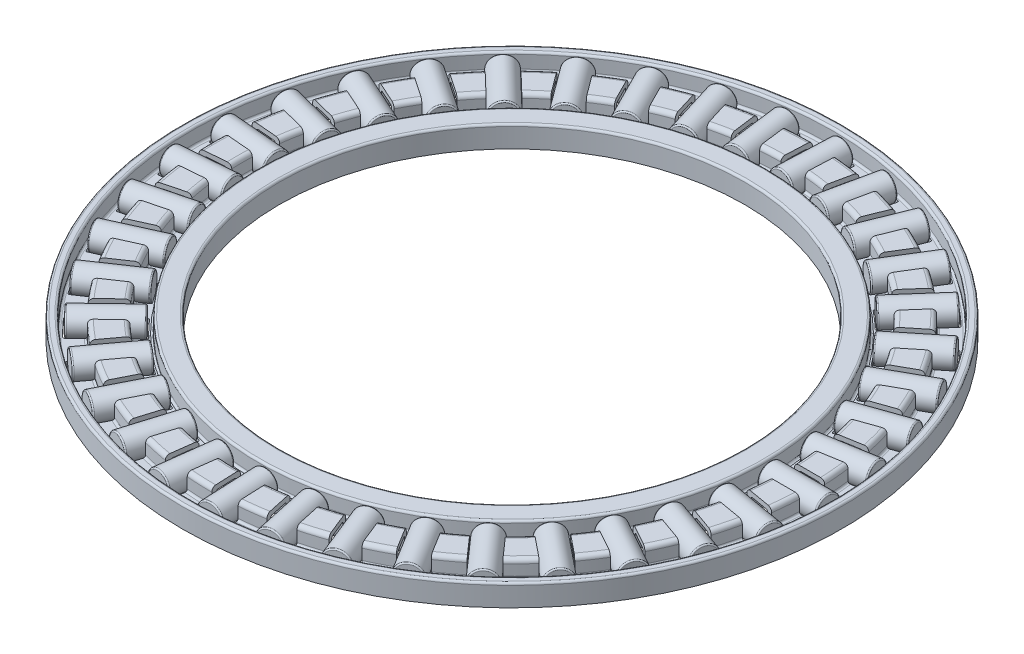
from build123d import *

# Parameters (mm, degrees)
FILLET1_R                = 0.492307692
FILLET2_R                = 0.492307692
FILLET3_R                = 0.25
FILLET4_R                = 0.246153846
CUT_EXTRUDE1_DEPTH       = 56.169064092
FILLET5_R                = 0.150039816
CIRPATTERN1_COUNT        = 37
FILLET5_OF_CIRPATTERN1_R = 0.150039816
SKETCH5_W                = 6.905422351
SKETCH5_H                = 1.5
FILLET6_R                = 0.150039816
CIRPATTERN2_COUNT        = 37


with BuildPart() as part:
    # Sketch3 → Revolve1 (revolve)
    with BuildSketch(Plane(origin=(0, 0, 0), x_dir=(0, 0, -1), z_dir=(1, 0, 0))):
        Polygon((28.353333333, -1.275), (28.353333333, 0.722307692), (29.176666667, 0.722307692), (29.176666667, -1.275), (32.524230769, -1.275), (32.524230769, 0.722307692), (34.985769231, 0.722307692), (34.985769231, -1.275), (38.333333333, -1.275), (38.333333333, 0.722307692), (38.666666667, 0.722307692), (38.666666667, -1.275), (39, -1.275), (39, 1.275), (38, 1.275), (38, -0.722307692), (35.538461538, -0.722307692), (35.538461538, 1.275), (31.971538462, 1.275), (31.971538462, -0.722307692), (30, -0.722307692), (30, 1.275), (27.53, 1.275), (27.53, -1.275), align=None)
    revolve(axis=Axis((0, 1.5, 0), (0, -1, 0)))

    # Fillet1
    fillet1_edges = [part.edges().sort_by_distance(p)[0] for p in [
        (0, -1.275, 34.985769231),
        (0, -1.275, 38.333333333),
        (0, -1.275, 29.176666667),
        (0, -1.275, 32.524230769),
    ]]
    fillet(fillet1_edges, radius=FILLET1_R)

    # Fillet2
    fillet2_edges = [part.edges().sort_by_distance(p)[0] for p in [
        (0, 1.275, 35.538461538),
        (0, 1.275, 31.971538462),
    ]]
    fillet(fillet2_edges, radius=FILLET2_R)

    # Fillet3
    fillet3_edges = [part.edges().sort_by_distance(p)[0] for p in [
        (0, 1.275, 38),
        (0, 1.275, 39),
        (0, 1.275, 30),
        (0, 1.275, 27.53),
    ]]
    fillet(fillet3_edges, radius=FILLET3_R)

    # Fillet4
    fillet4_edges = [part.edges().sort_by_distance(p)[0] for p in [
        (0, 0.722307692, 32.524230769),
        (0, 0.722307692, 34.985769231),
        (0, -0.722307692, 38),
        (0, -0.722307692, 35.538461538),
        (0, -0.722307692, 31.971538462),
        (0, -0.722307692, 30),
    ]]
    fillet(fillet4_edges, radius=FILLET4_R)

    # Sketch4 → Cut-Extrude1 (cut, symmetric)
    with BuildSketch(Plane(origin=(0, 0, 0), x_dir=(1, 0, 0), z_dir=(0, 1, 0))):
        with BuildLine():
            Line((30.362970869, 1.5), (37.570067873, 1.5))
            ThreePointArc((37.570067873, 1.5), (37.6, 0), (37.570067873, -1.5))
            Line((37.570067873, -1.5), (30.362970869, -1.5))
            ThreePointArc((30.362970869, -1.5), (30.4, 0), (30.362970869, 1.5))
        make_face()
    cut_extrude1 = extrude(amount=CUT_EXTRUDE1_DEPTH, both=True, mode=Mode.SUBTRACT)

    # Fillet5
    fillet5_edges = [part.edges().sort_by_distance(p)[0] for p in [
        (37.570067873, -0.998653846, -1.5),
        (37.570067873, -0.998653846, 1.5),
        (30.362970869, -0.998653846, -1.5),
        (30.362970869, -0.998653846, 1.5),
    ]]
    fillet(fillet5_edges, radius=FILLET5_R)

    # CirPattern1: Cut-Extrude1 ×37 about axis
    cirpattern1_axis = Axis((0, 1.5, 0), (0, -1, 0))
    for i in range(1, CIRPATTERN1_COUNT):
        add(cut_extrude1.rotate(cirpattern1_axis, i * 360 / CIRPATTERN1_COUNT), mode=Mode.SUBTRACT)

    # Fillet5 of CirPattern1
    fillet5_of_cirpattern1_edges = [part.edges().sort_by_distance(p)[0] for p in [
        (37.283157879, -0.998653846, 4.870948425),
        (36.776155418, -0.998653846, 7.827796156),
        (30.179728405, -0.998653846, 3.652943119),
        (29.672725944, -0.998653846, 6.60979085),
        (35.923679314, -0.998653846, 11.101768532),
        (34.92425993, -0.998653846, 13.930400868),
        (29.128270102, -0.998653846, 8.700797715),
        (28.128850718, -0.998653846, 11.529430051),
        (33.530741901, -0.998653846, 17.013210971),
        (32.06765707, -0.998653846, 19.63225331),
        (27.238844502, -0.998653846, 13.498346202),
        (25.775759671, -0.998653846, 16.117388542),
        (30.173186093, -0.998653846, 22.435214306),
        (28.288526102, -0.998653846, 24.769321569),
        (24.565806939, -0.998653846, 17.907571846),
        (22.681146948, -0.998653846, 20.241679109),
        (25.947602658, -0.998653846, 27.211797374),
        (23.695585742, -0.998653846, 29.193821544),
        (21.186055838, -0.998653846, 21.801629252),
        (18.934038922, -0.998653846, 23.783653422),
        (20.975553936, -0.998653846, 31.205546575),
        (18.420966523, -0.998653846, 32.778468426),
        (17.196820484, -0.998653846, 25.068493478),
        (14.642233071, -0.998653846, 26.641415329),
        (15.400076718, -0.998653846, 34.301569018),
        (12.616409636, -0.998653846, 35.420138451),
        (12.712863914, -0.998653846, 27.614182789),
        (9.929196832, -0.998653846, 28.732752222),
        (9.381567332, -0.998653846, 36.410797772),
        (6.448901615, -0.998653846, 37.042835582),
        (7.863181396, -0.998653846, 29.365462338),
        (4.930515679, -0.998653846, 29.997500148),
        (3.093167334, -0.998653846, 37.472554168),
        (0.095870435, -0.998653846, 37.599877777),
        (2.787289466, -0.998653846, 30.271951001),
        (-0.210007433, -0.998653846, 30.399274611),
        (-3.284217456, -0.998653846, 37.456293406),
        (-6.259918762, -0.998653846, 37.075239947),
        (-2.368787708, -0.998653846, 30.30757075),
        (-5.344489014, -0.998653846, 29.926517291),
        (-9.56712129, -0.998653846, 36.362483279),
        (-12.435621494, -0.998653846, 35.484014965),
        (-7.456719172, -0.998653846, 29.47129687),
        (-10.325219376, -0.998653846, 28.592828556),
        (-15.574796462, -0.998653846, 34.222590714),
        (-18.253574037, -0.998653846, 32.871979479),
        (-12.330134402, -0.998653846, 27.787187437),
        (-15.008911976, -0.998653846, 26.436576202),
        (-21.134413098, -0.998653846, 31.098176522),
        (-23.546404489, -0.998653846, 29.314276993),
        (-16.848834114, -0.998653846, 25.303691213),
        (-19.260825505, -0.998653846, 23.519791684),
        (-26.086031148, -0.998653846, 27.079124413),
        (-28.161847755, -0.998653846, 24.913256131),
        (-20.882823546, -0.998653846, 22.092253863),
        (-22.958640153, -0.998653846, 19.926385581),
        (-30.287201577, -0.998653846, 22.281055196),
        (-31.967125935, -0.998653846, 19.795526249),
        (-24.316052166, -0.998653846, 18.245262593),
        (-25.995976524, -0.998653846, 15.759733645),
        (-33.61706436, -0.998653846, 16.842000589),
        (-34.852768104, -0.998653846, 14.108315118),
        (-27.049752236, -0.998653846, 13.873388337),
        (-28.285455981, -0.998653846, 11.139702866),
        (-35.979825407, -0.998653846, 10.918432289),
        (-36.735759592, -0.998653846, 8.015233448),
        (-29.005280185, -0.998653846, 9.102401958),
        (-29.761214369, -0.998653846, 6.199203117),
        (-37.307512387, -0.998653846, 4.680760571),
        (-37.56193016, -0.998653846, 1.691568106),
        (-30.126379032, -0.998653846, 4.069556047),
        (-30.380796805, -0.998653846, 1.080363582),
        (-37.56193016, -0.998653846, -1.691568106),
        (-37.307512387, -0.998653846, -4.680760571),
        (-30.380796805, -0.998653846, -1.080363582),
        (-30.126379032, -0.998653846, -4.069556047),
        (-36.735759592, -0.998653846, -8.015233448),
        (-35.979825407, -0.998653846, -10.918432289),
        (-29.761214369, -0.998653846, -6.199203117),
        (-29.005280185, -0.998653846, -9.102401958),
        (-34.852768104, -0.998653846, -14.108315118),
        (-33.61706436, -0.998653846, -16.842000589),
        (-28.285455981, -0.998653846, -11.139702866),
        (-27.049752236, -0.998653846, -13.873388337),
        (-31.967125935, -0.998653846, -19.795526249),
        (-30.287201577, -0.998653846, -22.281055196),
        (-25.995976524, -0.998653846, -15.759733645),
        (-24.316052166, -0.998653846, -18.245262593),
        (-28.161847755, -0.998653846, -24.913256131),
        (-26.086031148, -0.998653846, -27.079124413),
        (-22.958640153, -0.998653846, -19.926385581),
        (-20.882823546, -0.998653846, -22.092253863),
        (-23.546404489, -0.998653846, -29.314276993),
        (-21.134413098, -0.998653846, -31.098176522),
        (-19.260825505, -0.998653846, -23.519791684),
        (-16.848834114, -0.998653846, -25.303691213),
        (-18.253574037, -0.998653846, -32.871979479),
        (-15.574796462, -0.998653846, -34.222590714),
        (-15.008911976, -0.998653846, -26.436576202),
        (-12.330134402, -0.998653846, -27.787187437),
        (-12.435621494, -0.998653846, -35.484014965),
        (-9.56712129, -0.998653846, -36.362483279),
        (-10.325219376, -0.998653846, -28.592828556),
        (-7.456719172, -0.998653846, -29.47129687),
        (-6.259918762, -0.998653846, -37.075239947),
        (-3.284217456, -0.998653846, -37.456293406),
        (-5.344489014, -0.998653846, -29.926517291),
        (-2.368787708, -0.998653846, -30.30757075),
        (0.095870435, -0.998653846, -37.599877777),
        (3.093167334, -0.998653846, -37.472554168),
        (-0.210007433, -0.998653846, -30.399274611),
        (2.787289466, -0.998653846, -30.271951001),
        (6.448901615, -0.998653846, -37.042835582),
        (9.381567332, -0.998653846, -36.410797772),
        (4.930515679, -0.998653846, -29.997500148),
        (7.863181396, -0.998653846, -29.365462338),
        (12.616409636, -0.998653846, -35.420138451),
        (15.400076718, -0.998653846, -34.301569018),
        (9.929196832, -0.998653846, -28.732752222),
        (12.712863914, -0.998653846, -27.614182789),
        (18.420966523, -0.998653846, -32.778468426),
        (20.975553936, -0.998653846, -31.205546575),
        (14.642233071, -0.998653846, -26.641415329),
        (17.196820484, -0.998653846, -25.068493478),
        (23.695585742, -0.998653846, -29.193821544),
        (25.947602658, -0.998653846, -27.211797374),
        (18.934038922, -0.998653846, -23.783653422),
        (21.186055838, -0.998653846, -21.801629252),
        (28.288526102, -0.998653846, -24.769321569),
        (30.173186093, -0.998653846, -22.435214306),
        (22.681146948, -0.998653846, -20.241679109),
        (24.565806939, -0.998653846, -17.907571846),
        (32.06765707, -0.998653846, -19.63225331),
        (33.530741901, -0.998653846, -17.013210971),
        (25.775759671, -0.998653846, -16.117388542),
        (27.238844502, -0.998653846, -13.498346202),
        (34.92425993, -0.998653846, -13.930400868),
        (35.923679314, -0.998653846, -11.101768532),
        (28.128850718, -0.998653846, -11.529430051),
        (29.128270102, -0.998653846, -8.700797715),
        (36.776155418, -0.998653846, -7.827796156),
        (37.283157879, -0.998653846, -4.870948425),
        (29.672725944, -0.998653846, -6.60979085),
        (30.179728405, -0.998653846, -3.652943119),
    ]]
    fillet(fillet5_of_cirpattern1_edges, radius=FILLET5_OF_CIRPATTERN1_R)


with BuildPart() as body_2:
    # Sketch5 → Revolve2 (revolve)
    with BuildSketch(Plane(origin=(0, 0, 0), x_dir=(1, 0, 0), z_dir=(0, 1, 0))):
        with Locations((33.972910066, 0.75)):
            Rectangle(SKETCH5_W, SKETCH5_H)
    revolve(axis=Axis((37.6, 0, 0), (-1, 0, 0)))

    # Fillet6
    fillet6_edges = [body_2.edges().sort_by_distance(p)[0] for p in [
        (30.52019889, 0, 1.5),
        (37.425621241, 0, 1.5),
    ]]
    fillet(fillet6_edges, radius=FILLET6_R)


with BuildPart() as cirpattern2_1:
    # CirPattern2: pattern copy
    add(body_2.part.rotate(Axis((0, 1.5, 0), (0, -1, 0)), 1 * 360 / CIRPATTERN2_COUNT))


with BuildPart() as cirpattern2_2:
    # CirPattern2: pattern copy
    add(body_2.part.rotate(Axis((0, 1.5, 0), (0, -1, 0)), 2 * 360 / CIRPATTERN2_COUNT))


with BuildPart() as cirpattern2_3:
    # CirPattern2: pattern copy
    add(body_2.part.rotate(Axis((0, 1.5, 0), (0, -1, 0)), 3 * 360 / CIRPATTERN2_COUNT))


with BuildPart() as cirpattern2_4:
    # CirPattern2: pattern copy
    add(body_2.part.rotate(Axis((0, 1.5, 0), (0, -1, 0)), 4 * 360 / CIRPATTERN2_COUNT))


with BuildPart() as cirpattern2_5:
    # CirPattern2: pattern copy
    add(body_2.part.rotate(Axis((0, 1.5, 0), (0, -1, 0)), 5 * 360 / CIRPATTERN2_COUNT))


with BuildPart() as cirpattern2_6:
    # CirPattern2: pattern copy
    add(body_2.part.rotate(Axis((0, 1.5, 0), (0, -1, 0)), 6 * 360 / CIRPATTERN2_COUNT))


with BuildPart() as cirpattern2_7:
    # CirPattern2: pattern copy
    add(body_2.part.rotate(Axis((0, 1.5, 0), (0, -1, 0)), 7 * 360 / CIRPATTERN2_COUNT))


with BuildPart() as cirpattern2_8:
    # CirPattern2: pattern copy
    add(body_2.part.rotate(Axis((0, 1.5, 0), (0, -1, 0)), 8 * 360 / CIRPATTERN2_COUNT))


with BuildPart() as cirpattern2_9:
    # CirPattern2: pattern copy
    add(body_2.part.rotate(Axis((0, 1.5, 0), (0, -1, 0)), 9 * 360 / CIRPATTERN2_COUNT))


with BuildPart() as cirpattern2_10:
    # CirPattern2: pattern copy
    add(body_2.part.rotate(Axis((0, 1.5, 0), (0, -1, 0)), 10 * 360 / CIRPATTERN2_COUNT))


with BuildPart() as cirpattern2_11:
    # CirPattern2: pattern copy
    add(body_2.part.rotate(Axis((0, 1.5, 0), (0, -1, 0)), 11 * 360 / CIRPATTERN2_COUNT))


with BuildPart() as cirpattern2_12:
    # CirPattern2: pattern copy
    add(body_2.part.rotate(Axis((0, 1.5, 0), (0, -1, 0)), 12 * 360 / CIRPATTERN2_COUNT))


with BuildPart() as cirpattern2_13:
    # CirPattern2: pattern copy
    add(body_2.part.rotate(Axis((0, 1.5, 0), (0, -1, 0)), 13 * 360 / CIRPATTERN2_COUNT))


with BuildPart() as cirpattern2_14:
    # CirPattern2: pattern copy
    add(body_2.part.rotate(Axis((0, 1.5, 0), (0, -1, 0)), 14 * 360 / CIRPATTERN2_COUNT))


with BuildPart() as cirpattern2_15:
    # CirPattern2: pattern copy
    add(body_2.part.rotate(Axis((0, 1.5, 0), (0, -1, 0)), 15 * 360 / CIRPATTERN2_COUNT))


with BuildPart() as cirpattern2_16:
    # CirPattern2: pattern copy
    add(body_2.part.rotate(Axis((0, 1.5, 0), (0, -1, 0)), 16 * 360 / CIRPATTERN2_COUNT))


with BuildPart() as cirpattern2_17:
    # CirPattern2: pattern copy
    add(body_2.part.rotate(Axis((0, 1.5, 0), (0, -1, 0)), 17 * 360 / CIRPATTERN2_COUNT))


with BuildPart() as cirpattern2_18:
    # CirPattern2: pattern copy
    add(body_2.part.rotate(Axis((0, 1.5, 0), (0, -1, 0)), 18 * 360 / CIRPATTERN2_COUNT))


with BuildPart() as cirpattern2_19:
    # CirPattern2: pattern copy
    add(body_2.part.rotate(Axis((0, 1.5, 0), (0, -1, 0)), 19 * 360 / CIRPATTERN2_COUNT))


with BuildPart() as cirpattern2_20:
    # CirPattern2: pattern copy
    add(body_2.part.rotate(Axis((0, 1.5, 0), (0, -1, 0)), 20 * 360 / CIRPATTERN2_COUNT))


with BuildPart() as cirpattern2_21:
    # CirPattern2: pattern copy
    add(body_2.part.rotate(Axis((0, 1.5, 0), (0, -1, 0)), 21 * 360 / CIRPATTERN2_COUNT))


with BuildPart() as cirpattern2_22:
    # CirPattern2: pattern copy
    add(body_2.part.rotate(Axis((0, 1.5, 0), (0, -1, 0)), 22 * 360 / CIRPATTERN2_COUNT))


with BuildPart() as cirpattern2_23:
    # CirPattern2: pattern copy
    add(body_2.part.rotate(Axis((0, 1.5, 0), (0, -1, 0)), 23 * 360 / CIRPATTERN2_COUNT))


with BuildPart() as cirpattern2_24:
    # CirPattern2: pattern copy
    add(body_2.part.rotate(Axis((0, 1.5, 0), (0, -1, 0)), 24 * 360 / CIRPATTERN2_COUNT))


with BuildPart() as cirpattern2_25:
    # CirPattern2: pattern copy
    add(body_2.part.rotate(Axis((0, 1.5, 0), (0, -1, 0)), 25 * 360 / CIRPATTERN2_COUNT))


with BuildPart() as cirpattern2_26:
    # CirPattern2: pattern copy
    add(body_2.part.rotate(Axis((0, 1.5, 0), (0, -1, 0)), 26 * 360 / CIRPATTERN2_COUNT))


with BuildPart() as cirpattern2_27:
    # CirPattern2: pattern copy
    add(body_2.part.rotate(Axis((0, 1.5, 0), (0, -1, 0)), 27 * 360 / CIRPATTERN2_COUNT))


with BuildPart() as cirpattern2_28:
    # CirPattern2: pattern copy
    add(body_2.part.rotate(Axis((0, 1.5, 0), (0, -1, 0)), 28 * 360 / CIRPATTERN2_COUNT))


with BuildPart() as cirpattern2_29:
    # CirPattern2: pattern copy
    add(body_2.part.rotate(Axis((0, 1.5, 0), (0, -1, 0)), 29 * 360 / CIRPATTERN2_COUNT))


with BuildPart() as cirpattern2_30:
    # CirPattern2: pattern copy
    add(body_2.part.rotate(Axis((0, 1.5, 0), (0, -1, 0)), 30 * 360 / CIRPATTERN2_COUNT))


with BuildPart() as cirpattern2_31:
    # CirPattern2: pattern copy
    add(body_2.part.rotate(Axis((0, 1.5, 0), (0, -1, 0)), 31 * 360 / CIRPATTERN2_COUNT))


with BuildPart() as cirpattern2_32:
    # CirPattern2: pattern copy
    add(body_2.part.rotate(Axis((0, 1.5, 0), (0, -1, 0)), 32 * 360 / CIRPATTERN2_COUNT))


with BuildPart() as cirpattern2_33:
    # CirPattern2: pattern copy
    add(body_2.part.rotate(Axis((0, 1.5, 0), (0, -1, 0)), 33 * 360 / CIRPATTERN2_COUNT))


with BuildPart() as cirpattern2_34:
    # CirPattern2: pattern copy
    add(body_2.part.rotate(Axis((0, 1.5, 0), (0, -1, 0)), 34 * 360 / CIRPATTERN2_COUNT))


with BuildPart() as cirpattern2_35:
    # CirPattern2: pattern copy
    add(body_2.part.rotate(Axis((0, 1.5, 0), (0, -1, 0)), 35 * 360 / CIRPATTERN2_COUNT))


with BuildPart() as cirpattern2_36:
    # CirPattern2: pattern copy
    add(body_2.part.rotate(Axis((0, 1.5, 0), (0, -1, 0)), 36 * 360 / CIRPATTERN2_COUNT))


solid = Compound([part.part, body_2.part, cirpattern2_1.part, cirpattern2_2.part, cirpattern2_3.part, cirpattern2_4.part, cirpattern2_5.part, cirpattern2_6.part, cirpattern2_7.part, cirpattern2_8.part, cirpattern2_9.part, cirpattern2_10.part, cirpattern2_11.part, cirpattern2_12.part, cirpattern2_13.part, cirpattern2_14.part, cirpattern2_15.part, cirpattern2_16.part, cirpattern2_17.part, cirpattern2_18.part, cirpattern2_19.part, cirpattern2_20.part, cirpattern2_21.part, cirpattern2_22.part, cirpattern2_23.part, cirpattern2_24.part, cirpattern2_25.part, cirpattern2_26.part, cirpattern2_27.part, cirpattern2_28.part, cirpattern2_29.part, cirpattern2_30.part, cirpattern2_31.part, cirpattern2_32.part, cirpattern2_33.part, cirpattern2_34.part, cirpattern2_35.part, cirpattern2_36.part])
